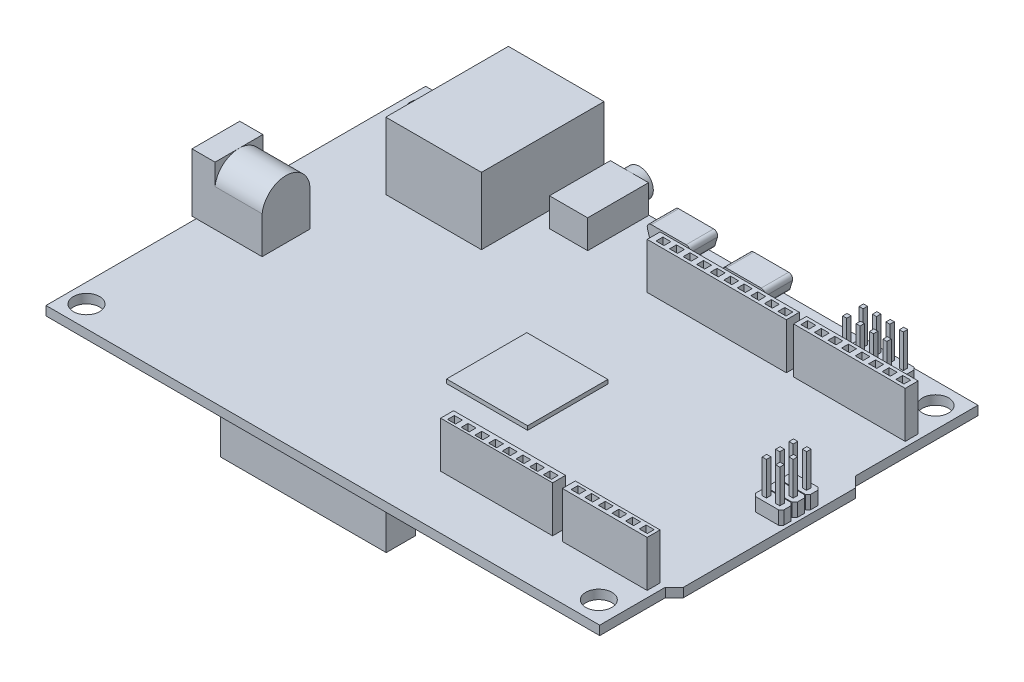
from build123d import *

# Parameters (mm, degrees)
BOSS_EXTRUDE1_DEPTH        = 1.7272
SKETCH2_W                  = 21.217281059
SKETCH2_H                  = 2.4511
SKETCH2_W_2                = 1.513193634
SKETCH2_H_2                = 1.296771929
SKETCH2_W_3                = 1.513193633
SKETCH2_W_4                = 26.382083001
SKETCH2_W_5                = 21.16618469
SKETCH2_W_6                = 16.065754975
BOSS_EXTRUDE2_DEPTH        = 8.7122
SKETCH3_W                  = 18.131785795
SKETCH3_H                  = 23.236925684
BOSS_EXTRUDE3_DEPTH        = 12.7
CUT_EXTRUDE1_DEPTH         = 13.076925684
SKETCH5_R                  = 2.483178102
CUT_EXTRUDE2_DEPTH         = 67.517320561
SKETCH6_W                  = 13.295757417
SKETCH6_H                  = 9.058997538
BOSS_EXTRUDE4_DEPTH        = 11.0617
CUT_EXTRUDE3_DEPTH         = 103.229340264
CUT_EXTRUDE3_DEPTH_BACK    = 8.921342
SKETCH8_R                  = 3.845118777
CUT_EXTRUDE4_DEPTH         = 10.755757417
SKETCH9_R                  = 0.95125876
BOSS_EXTRUDE5_DEPTH        = 9.485757417
FILLET1_R                  = 0.508
SKETCH10_W                 = 7.23202982
SKETCH10_H                 = 11.540892392
BOSS_EXTRUDE6_DEPTH        = 5.3975
SKETCH11_R                 = 2.615461053
BOSS_EXTRUDE8_DEPTH        = 1.905
SKETCH12_R                 = 2.059888478
CUT_EXTRUDE5_DEPTH         = 11.540892391
BOSS_EXTRUDE9_START        = -4.445
BOSS_EXTRUDE9_DEPTH        = 5.207
CUT_EXTRUDE6_DEPTH         = 4.699
LPATTERN1_COUNT            = 2
LPATTERN1_PITCH            = 14.224
SKETCH15_W                 = 2.566307228
SKETCH15_H                 = 5.471560695
BOSS_EXTRUDE10_DEPTH       = 1.524
CHAMFER1_SIZE              = 0.508
SKETCH16_W                 = 0.756408132
SKETCH16_H                 = 0.825705557
BOSS_EXTRUDE11_DEPTH       = 6.35
LPATTERN2_DEPTH            = 1.524
LPATTERN2_START            = 1.524
LPATTERN2_2_OUTLINE_W      = 0.756408132
LPATTERN2_2_OUTLINE_H      = 0.825705557
LPATTERN2_2_DEPTH          = 6.35
SKETCH17_W                 = 5.405221112
SKETCH17_H                 = 2.387582332
BOSS_EXTRUDE12_DEPTH       = 2.54
CHAMFER2_SIZE              = 0.508
SKETCH18_W                 = 0.799057006
SKETCH18_H                 = 0.852959092
BOSS_EXTRUDE13_DEPTH       = 6.35
LPATTERN3_COUNT            = 3
LPATTERN3_PITCH            = 2.54
CHAMFER2_OF_LPATTERN3_SIZE = 0.508
SKETCH19_W                 = 31.401054305
SKETCH19_H                 = 7.62
BOSS_EXTRUDE14_DEPTH       = 9.144
SKETCH20_W                 = 31.401054305
SKETCH20_H                 = 2.032
CUT_EXTRUDE7_DEPTH         = 2.54
CUT_EXTRUDE8_DEPTH         = 6.35
SKETCH23_W                 = 6.340454958
SKETCH23_H                 = 6.340454959
BOSS_EXTRUDE15_DEPTH       = 6.858
SKETCH24_W                 = 2.58532541
SKETCH24_H                 = 2.364612325
BOSS_EXTRUDE16_DEPTH       = 3.81
CUT_EXTRUDE10_DEPTH        = 3.81
SKETCH26_W                 = 18.796
SKETCH26_H                 = 3.305722841
BOSS_EXTRUDE17_DEPTH       = 3.81
SKETCH27_W                 = 15.358405724
SKETCH27_H                 = 15.207579987
BOSS_EXTRUDE18_DEPTH       = 0.762


# Read off the part's stored shape, not the designer's step: LPattern2
with BuildPart() as part:
    # Sketch1 → Boss-Extrude1 (new body)
    with BuildSketch(Plane(origin=(0, 0, 0), x_dir=(1, 0, 0), z_dir=(0, 1, 0))):
        Polygon((51.361416482, 35.975), (51.361416482, 12.721357533), (53.33, 10.752774016), (53.33, -21.826585236), (51.614836507, -23.54174873), (51.614836507, -35.975), (-53.33, -35.975), (-53.33, 35.975), align=None)
    extrude(amount=-BOSS_EXTRUDE1_DEPTH)

    # Sketch2 → Boss-Extrude2 (add)
    # profile 1 of 4: a face of its own
    with BuildSketch(Plane(origin=(0, 0, 0), x_dir=(1, 0, 0), z_dir=(0, 1, 0))):
        with Locations((21.887442101, -24.561512356)):
            Rectangle(SKETCH2_W, SKETCH2_H)
        with Locations((12.892277859, -24.693181102)):
            Rectangle(SKETCH2_W_2, SKETCH2_H_2, mode=Mode.SUBTRACT)
        with Locations((15.487359642, -24.693181102)):
            Rectangle(SKETCH2_W_2, SKETCH2_H_2, mode=Mode.SUBTRACT)
        with Locations((18.082441426, -24.693181102)):
            Rectangle(SKETCH2_W_3, SKETCH2_H_2, mode=Mode.SUBTRACT)
        with Locations((20.677523209, -24.693181102)):
            Rectangle(SKETCH2_W_3, SKETCH2_H_2, mode=Mode.SUBTRACT)
        with Locations((23.272604992, -24.693181102)):
            Rectangle(SKETCH2_W_2, SKETCH2_H_2, mode=Mode.SUBTRACT)
        with Locations((25.867686775, -24.693181102)):
            Rectangle(SKETCH2_W_2, SKETCH2_H_2, mode=Mode.SUBTRACT)
        with Locations((28.462768558, -24.693181102)):
            Rectangle(SKETCH2_W_2, SKETCH2_H_2, mode=Mode.SUBTRACT)
        with Locations((31.057850342, -24.693181102)):
            Rectangle(SKETCH2_W_3, SKETCH2_H_2, mode=Mode.SUBTRACT)
    # profile 2 of 4: a face of its own
    with BuildSketch(Plane(origin=(0, 0, 0), x_dir=(1, 0, 0), z_dir=(0, 1, 0))):
        with Locations((14.695869752, 24.354639302)):
            Rectangle(SKETCH2_W_4, SKETCH2_H)
        with Locations((5.934436371, 24.354639303)):
            Rectangle(SKETCH2_W_3, SKETCH2_H_2, mode=Mode.SUBTRACT)
        with Locations((3.366377141, 24.354639303)):
            Rectangle(SKETCH2_W_3, SKETCH2_H_2, mode=Mode.SUBTRACT)
        with Locations((8.5024956, 24.354639303)):
            Rectangle(SKETCH2_W_3, SKETCH2_H_2, mode=Mode.SUBTRACT)
        with Locations((11.070554831, 24.354639303)):
            Rectangle(SKETCH2_W_3, SKETCH2_H_2, mode=Mode.SUBTRACT)
        with Locations((13.638614061, 24.354639303)):
            Rectangle(SKETCH2_W_3, SKETCH2_H_2, mode=Mode.SUBTRACT)
        with Locations((16.20667329, 24.354639303)):
            Rectangle(SKETCH2_W_3, SKETCH2_H_2, mode=Mode.SUBTRACT)
        with Locations((18.77473252, 24.354639303)):
            Rectangle(SKETCH2_W_2, SKETCH2_H_2, mode=Mode.SUBTRACT)
        with Locations((21.34279175, 24.354639303)):
            Rectangle(SKETCH2_W_2, SKETCH2_H_2, mode=Mode.SUBTRACT)
        with Locations((23.91085098, 24.354639303)):
            Rectangle(SKETCH2_W_2, SKETCH2_H_2, mode=Mode.SUBTRACT)
        with Locations((26.47891021, 24.354639303)):
            Rectangle(SKETCH2_W_2, SKETCH2_H_2, mode=Mode.SUBTRACT)
    # profile 3 of 4: a face of its own
    with BuildSketch(Plane(origin=(0, 0, 0), x_dir=(1, 0, 0), z_dir=(0, 1, 0))):
        with Locations((39.830648216, 24.354639302)):
            Rectangle(SKETCH2_W_5, SKETCH2_H)
        with Locations((30.808480441, 24.359914849)):
            Rectangle(SKETCH2_W_3, SKETCH2_H_2, mode=Mode.SUBTRACT)
        with Locations((33.381224519, 24.359914849)):
            Rectangle(SKETCH2_W_3, SKETCH2_H_2, mode=Mode.SUBTRACT)
        with Locations((35.953968597, 24.359914849)):
            Rectangle(SKETCH2_W_3, SKETCH2_H_2, mode=Mode.SUBTRACT)
        with Locations((38.526712675, 24.359914849)):
            Rectangle(SKETCH2_W_2, SKETCH2_H_2, mode=Mode.SUBTRACT)
        with Locations((41.099456753, 24.359914849)):
            Rectangle(SKETCH2_W_2, SKETCH2_H_2, mode=Mode.SUBTRACT)
        with Locations((43.672200831, 24.359914849)):
            Rectangle(SKETCH2_W_2, SKETCH2_H_2, mode=Mode.SUBTRACT)
        with Locations((46.244944909, 24.359914849)):
            Rectangle(SKETCH2_W_2, SKETCH2_H_2, mode=Mode.SUBTRACT)
        with Locations((48.817688987, 24.359914849)):
            Rectangle(SKETCH2_W_2, SKETCH2_H_2, mode=Mode.SUBTRACT)
    # profile 4 of 4: a face of its own
    with BuildSketch(Plane(origin=(0, 0, 0), x_dir=(1, 0, 0), z_dir=(0, 1, 0))):
        with Locations((42.380863074, -24.561512356)):
            Rectangle(SKETCH2_W_6, SKETCH2_H)
        with Locations((36.113955365, -24.495526938)):
            Rectangle(SKETCH2_W_3, SKETCH2_H_2, mode=Mode.SUBTRACT)
        with Locations((38.700163929, -24.495526938)):
            Rectangle(SKETCH2_W_2, SKETCH2_H_2, mode=Mode.SUBTRACT)
        with Locations((41.286372494, -24.495526938)):
            Rectangle(SKETCH2_W_2, SKETCH2_H_2, mode=Mode.SUBTRACT)
        with Locations((43.872581059, -24.495526938)):
            Rectangle(SKETCH2_W_3, SKETCH2_H_2, mode=Mode.SUBTRACT)
        with Locations((46.458789624, -24.495526938)):
            Rectangle(SKETCH2_W_3, SKETCH2_H_2, mode=Mode.SUBTRACT)
        with Locations((49.044998188, -24.495526938)):
            Rectangle(SKETCH2_W_2, SKETCH2_H_2, mode=Mode.SUBTRACT)
    extrude(amount=BOSS_EXTRUDE2_DEPTH)

    # Sketch3 → Boss-Extrude3 (add)
    with BuildSketch(Plane(origin=(0, 0, 0), x_dir=(1, 0, 0), z_dir=(0, 1, 0))):
        with Locations((-30.278321912, 26.053476777)):
            Rectangle(SKETCH3_W, SKETCH3_H)
    extrude(amount=BOSS_EXTRUDE3_DEPTH)

    # Sketch4 → Cut-Extrude1 (cut)
    with BuildSketch(Plane(origin=(0, 0, -37.671939619), x_dir=(-1, 0, 0), z_dir=(0, 0, -1))):
        Polygon((27.837662892, 10.126027768), (27.837662892, 11.937827276), (32.718980931, 11.937827276), (32.718980931, 10.126027768), (37.5005936, 10.126027768), (37.5005936, 1.167685758), (23.056050223, 1.167685758), (23.056050223, 10.126027768), align=None)
    extrude(amount=-CUT_EXTRUDE1_DEPTH, mode=Mode.SUBTRACT)

    # Sketch5 → Cut-Extrude2 (cut, through all)
    with BuildSketch(Plane(origin=(0, 0, 0), x_dir=(1, 0, 0), z_dir=(0, 1, 0))):
        with Locations(Location((-49.71750702, 31.911979039, 0), (0, 0, 270))):
            Circle(SKETCH5_R)
        with Locations(Location((47.377368709, 31.911979039, 0), (0, 0, 270))):
            Circle(SKETCH5_R)
        with Locations(Location((47.377368709, -31.908062762, 0), (0, 0, 270))):
            Circle(SKETCH5_R)
        with Locations(Location((-49.71750702, -31.908062762, 0), (0, 0, 270))):
            Circle(SKETCH5_R)
    extrude(amount=-CUT_EXTRUDE2_DEPTH, mode=Mode.SUBTRACT)

    # Sketch6 → Boss-Extrude4 (add)
    with BuildSketch(Plane(origin=(0, 0, 0), x_dir=(1, 0, 0), z_dir=(0, 1, 0))):
        with Locations((-47.500536221, -2.963140184)):
            Rectangle(SKETCH6_W, SKETCH6_H)
    extrude(amount=BOSS_EXTRUDE4_DEPTH)

    # Sketch7 → Cut-Extrude3 (cut, two sides: drawn at the far end of the back side and taken through both)
    with BuildSketch(Plane(origin=(-40.852657513, 0, 0), x_dir=(0, 0, -1), z_dir=(1, 0, 0)).offset(-CUT_EXTRUDE3_DEPTH_BACK)):
        with BuildLine():
            Line((-7.492638953, 7.04685454), (-7.492638953, 13.052105642))
            Line((-7.492638953, 13.052105642), (1.566358585, 13.052105642))
            Line((1.566358585, 13.052105642), (1.566358585, 7.04685454))
            ThreePointArc((1.566358585, 7.04685454), (-2.963140184, 11.0617), (-7.492638953, 7.04685454))
        make_face()
    extrude(amount=CUT_EXTRUDE3_DEPTH + CUT_EXTRUDE3_DEPTH_BACK, mode=Mode.SUBTRACT)

    # Sketch8 → Cut-Extrude4 (cut)
    with BuildSketch(Plane.ZY.offset(54.14841493)):
        with Locations((2.963140184, 6.499215151)):
            Circle(SKETCH8_R)
    extrude(amount=-CUT_EXTRUDE4_DEPTH, mode=Mode.SUBTRACT)

    # Sketch9 → Boss-Extrude5 (add)
    with BuildSketch(Plane.ZY.offset(43.392657513)):
        with Locations(Location((2.963140184, 6.499215151, 0), (0, 0, 180))):
            Circle(SKETCH9_R)
    extrude(amount=BOSS_EXTRUDE5_DEPTH)

    # Fillet1
    fillet1_edges = [part.edges().sort_by_distance(p)[0] for p in [
        (-52.87841493, 6.499215151, 3.914398944),
    ]]
    fillet(fillet1_edges, radius=FILLET1_R)

    # Sketch10 → Boss-Extrude6 (add)
    with BuildSketch(Plane(origin=(0, 0, 0), x_dir=(1, 0, 0), z_dir=(0, 1, 0))):
        with Locations((-14.60400572, 30.111460287)):
            Rectangle(SKETCH10_W, SKETCH10_H)
    extrude(amount=BOSS_EXTRUDE6_DEPTH)

    # Sketch11 → Boss-Extrude8 (add)
    with BuildSketch(Plane(origin=(0, 0, -35.881906483), x_dir=(-1, 0, 0), z_dir=(0, 0, -1))):
        with Locations(Location((14.60400572, 2.69875, 0), (0, 0, 180))):
            Circle(SKETCH11_R)
    extrude(amount=BOSS_EXTRUDE8_DEPTH)

    # Sketch12 → Cut-Extrude5 (cut)
    with BuildSketch(Plane(origin=(0, 0, -37.786906483), x_dir=(-1, 0, 0), z_dir=(0, 0, -1))):
        with Locations((14.60400572, 2.69875)):
            Circle(SKETCH12_R)
    extrude(amount=-CUT_EXTRUDE5_DEPTH, mode=Mode.SUBTRACT)

    # Sketch13 → Boss-Extrude9 (add)
    with BuildSketch(Plane(origin=(0, 0, -35.975), x_dir=(-1, 0, 0), z_dir=(0, 0, -1)).offset(BOSS_EXTRUDE9_START)):
        with BuildLine():
            Line((-14.236695776, 0), (-8.585922104, 0))
            ThreePointArc((-8.585922104, 0), (-8.13148913, 0.150334509), (-7.856365758, 0.542019232))
            Line((-7.856365758, 0.542019232), (-7.373862622, 2.142219232))
            ThreePointArc((-7.373862622, 2.142219232), (-7.491753477, 2.816632974), (-8.103418968, 3.1242))
            Line((-8.103418968, 3.1242), (-14.719198912, 3.1242))
            ThreePointArc((-14.719198912, 3.1242), (-15.330864402, 2.816632974), (-15.448755257, 2.142219232))
            Line((-15.448755257, 2.142219232), (-14.966252121, 0.542019232))
            ThreePointArc((-14.966252121, 0.542019232), (-14.691128749, 0.150334509), (-14.236695776, 0))
        make_face()
    boss_extrude9 = extrude(amount=BOSS_EXTRUDE9_DEPTH)

    # Sketch14 → Cut-Extrude6 (cut)
    with BuildSketch(Plane(origin=(0, 0, -36.737), x_dir=(-1, 0, 0), z_dir=(0, 0, -1))):
        with BuildLine():
            Line((-8.103418968, 2.8702), (-14.719198912, 2.8702))
            ThreePointArc((-14.719198912, 2.8702), (-15.126975905, 2.665155316), (-15.205569809, 2.215546155))
            Line((-15.205569809, 2.215546155), (-14.723066673, 0.615346155))
            ThreePointArc((-14.723066673, 0.615346155), (-14.539651091, 0.354223006), (-14.236695776, 0.254))
            Line((-14.236695776, 0.254), (-11.591805715, 0.254))
            Line((-11.591805715, 0.254), (-11.591805715, 0))
            Line((-11.591805715, 0), (-11.230812165, 0))
            Line((-11.230812165, 0), (-11.230812165, 0.254))
            Line((-11.230812165, 0.254), (-8.585922104, 0.254))
            ThreePointArc((-8.585922104, 0.254), (-8.282966788, 0.354223006), (-8.099551207, 0.615346155))
            Line((-8.099551207, 0.615346155), (-7.617048071, 2.215546155))
            ThreePointArc((-7.617048071, 2.215546155), (-7.695641974, 2.665155316), (-8.103418968, 2.8702))
        make_face()
    cut_extrude6 = extrude(amount=-CUT_EXTRUDE6_DEPTH, mode=Mode.SUBTRACT)

    # LPattern1: Boss-Extrude9, Cut-Extrude6 ×2
    with Locations(*[(-i * LPATTERN1_PITCH, 0, 0) for i in range(1, LPATTERN1_COUNT)]):
        add(boss_extrude9)
        add(cut_extrude6, mode=Mode.SUBTRACT)

    # Sketch15 → Boss-Extrude10 (add)
    with BuildSketch(Plane(origin=(0, 0, 0), x_dir=(1, 0, 0), z_dir=(0, 1, 0))):
        with Locations((32.140541448, 31.899882326)):
            Rectangle(SKETCH15_W, SKETCH15_H)
    extrude(amount=BOSS_EXTRUDE10_DEPTH)

    # Chamfer1
    chamfer1_edges = [part.edges().sort_by_distance(p)[0] for p in [
        (30.857387834, 0.762, -34.635662673),
        (30.857387834, 0.762, -29.164101978),
        (33.423695062, 0.762, -29.164101978),
        (33.423695062, 0.762, -34.635662673),
    ]]
    chamfer(chamfer1_edges, length=CHAMFER1_SIZE)

    # Sketch16 → Boss-Extrude11 (add)
    with BuildSketch(Plane(origin=(0, 1.524, 0), x_dir=(1, 0, 0), z_dir=(0, 1, 0))):
        with Locations((32.140541448, 30.343807186)):
            Rectangle(SKETCH16_W, SKETCH16_H)
        with Locations((32.140541448, 33.455957466)):
            Rectangle(SKETCH16_W, SKETCH16_H)
    extrude(amount=BOSS_EXTRUDE11_DEPTH)

    # LPattern2 outline → LPattern2 (add)
    with BuildSketch(Plane(origin=(0, 0, 0), x_dir=(1, 0, 0), z_dir=(0, 1, 0))):
        Polygon((33.905387834, 29.164101978), (35.455695062, 29.164101978), (35.950541448, 29.658948364), (36.445387834, 29.164101978), (37.995695062, 29.164101978), (38.490541448, 29.658948364), (38.985387834, 29.164101978), (40.535695062, 29.164101978), (41.043695062, 29.672101978), (41.043695062, 34.127662673), (40.535695062, 34.635662673), (38.985387834, 34.635662673), (38.490541448, 34.140816287), (37.995695062, 34.635662673), (36.445387834, 34.635662673), (35.950541448, 34.140816287), (35.455695062, 34.635662673), (33.905387834, 34.635662673), (33.410541448, 34.140816287), (33.423695062, 34.127662673), (33.423695062, 29.672101978), (33.410541448, 29.658948364), align=None)
    extrude(amount=LPATTERN2_DEPTH)

    # LPattern2 2 outline → LPattern2 2 (add)
    with BuildSketch(Plane(origin=(0, 0, 0), x_dir=(1, 0, 0), z_dir=(0, 1, 0)).offset(LPATTERN2_START)):
        with Locations((34.680541448, 33.455957466)):
            Rectangle(LPATTERN2_2_OUTLINE_W, LPATTERN2_2_OUTLINE_H)
        with Locations((37.220541448, 33.455957466)):
            Rectangle(LPATTERN2_2_OUTLINE_W, LPATTERN2_2_OUTLINE_H)
        with Locations((39.760541448, 33.455957466)):
            Rectangle(LPATTERN2_2_OUTLINE_W, LPATTERN2_2_OUTLINE_H)
        with Locations((34.680541448, 30.343807186)):
            Rectangle(LPATTERN2_2_OUTLINE_W, LPATTERN2_2_OUTLINE_H)
        with Locations((37.220541448, 30.343807186)):
            Rectangle(LPATTERN2_2_OUTLINE_W, LPATTERN2_2_OUTLINE_H)
        with Locations((39.760541448, 30.343807186)):
            Rectangle(LPATTERN2_2_OUTLINE_W, LPATTERN2_2_OUTLINE_H)
    extrude(amount=LPATTERN2_2_DEPTH)

    # Sketch17 → Boss-Extrude12 (add)
    with BuildSketch(Plane(origin=(0, 0, 0), x_dir=(1, 0, 0), z_dir=(0, 1, 0))):
        with Locations((49.969340977, 3.638067028)):
            Rectangle(SKETCH17_W, SKETCH17_H)
    boss_extrude12 = extrude(amount=BOSS_EXTRUDE12_DEPTH)

    # Chamfer2
    chamfer2_edges = [part.edges().sort_by_distance(p)[0] for p in [
        (47.266730421, 1.27, -4.831858194),
        (47.266730421, 1.27, -2.444275862),
        (52.671951533, 1.27, -2.444275862),
        (52.671951533, 1.27, -4.831858194),
    ]]
    chamfer(chamfer2_edges, length=CHAMFER2_SIZE)

    # Sketch18 → Boss-Extrude13 (add)
    with BuildSketch(Plane(origin=(0, 2.54, 0), x_dir=(1, 0, 0), z_dir=(0, 1, 0))):
        with Locations((48.699340977, 3.638067028)):
            Rectangle(SKETCH18_W, SKETCH18_H)
        with Locations((51.239340977, 3.638067028)):
            Rectangle(SKETCH18_W, SKETCH18_H)
    boss_extrude13 = extrude(amount=BOSS_EXTRUDE13_DEPTH)

    # LPattern3: Boss-Extrude12, Boss-Extrude13 ×3
    with Locations(*[(0, 0, i * LPATTERN3_PITCH) for i in range(1, LPATTERN3_COUNT)]):
        add(boss_extrude12)
        add(boss_extrude13)

    # Chamfer2 of LPattern3
    chamfer2_of_lpattern3_edges = [part.edges().sort_by_distance(p)[0] for p in [
        (47.266730421, 1.27, -2.291858194),
        (47.266730421, 1.27, 0.095724138),
        (52.671951533, 1.27, 0.095724138),
        (52.671951533, 1.27, -2.291858194),
        (47.266730421, 1.27, 0.248141806),
        (47.266730421, 1.27, 2.635724138),
        (52.671951533, 1.27, 2.635724138),
        (52.671951533, 1.27, 0.248141806),
    ]]
    chamfer(chamfer2_of_lpattern3_edges, length=CHAMFER2_OF_LPATTERN3_SIZE)

    # Sketch19 → Boss-Extrude14 (add)
    with BuildSketch(Plane.XZ.offset(1.7272)):
        with Locations((-7.08382712, 29.625)):
            Rectangle(SKETCH19_W, SKETCH19_H)
    extrude(amount=BOSS_EXTRUDE14_DEPTH)

    # Sketch20 → Cut-Extrude7 (cut)
    with BuildSketch(Plane.XZ.offset(10.8712)):
        with Locations((-7.08382712, 26.831)):
            Rectangle(SKETCH20_W, SKETCH20_H)
    extrude(amount=-CUT_EXTRUDE7_DEPTH, mode=Mode.SUBTRACT)

    # Sketch21 → Cut-Extrude8 (cut)
    with BuildSketch(Plane(origin=(0, 0, 25.815), x_dir=(-1, 0, 0), z_dir=(0, 0, -1))):
        Polygon((21.14926178, -8.3312), (21.14926178, -7.80050592), (4.740153087, -7.80050592), (4.740153087, -8.3312), (1.476806404, -8.3312), (1.476806404, -7.80050592), (-7.217209049, -7.80050592), (-7.217209049, -10.378645231), (21.14926178, -10.378645231), align=None)
    extrude(amount=-CUT_EXTRUDE8_DEPTH, mode=Mode.SUBTRACT)

    # Sketch23 → Boss-Extrude15 (add)
    with BuildSketch(Plane.XZ.offset(1.7272)):
        with Locations((-19.336685896, -18.866082027)):
            Rectangle(SKETCH23_W, SKETCH23_H)
    boss_extrude15 = extrude(amount=BOSS_EXTRUDE15_DEPTH)

    # Sketch24 → Boss-Extrude16 (add)
    with BuildSketch(Plane.XZ.offset(8.5852)):
        with Locations((-20.366923864, -18.871628079)):
            Rectangle(SKETCH24_W, SKETCH24_H)
    boss_extrude16 = extrude(amount=BOSS_EXTRUDE16_DEPTH)

    # Sketch25 → Cut-Extrude10 (cut)
    with BuildSketch(Plane(origin=(0, 0, -20.053934242), x_dir=(-1, 0, 0), z_dir=(0, 0, -1))):
        Polygon((20.452892409, -8.5852), (20.452892409, -10.378645231), (21.659586569, -10.378645231), (20.021801155, -12.3952), (23.172083399, -12.3952), (23.172083399, -8.5852), align=None)
    cut_extrude10 = extrude(amount=-CUT_EXTRUDE10_DEPTH, mode=Mode.SUBTRACT)

    # Mirror1: Boss-Extrude15, Boss-Extrude16, Cut-Extrude10 across plane
    add(boss_extrude15.mirror(Plane(origin=(-6.768458417, 0, 0), x_dir=(0, 0, 1), z_dir=(1, 0, 0))))
    add(boss_extrude16.mirror(Plane(origin=(-6.768458417, 0, 0), x_dir=(0, 0, 1), z_dir=(1, 0, 0))))
    add(cut_extrude10.mirror(Plane(origin=(-6.768458417, 0, 0), x_dir=(0, 0, 1), z_dir=(1, 0, 0))), mode=Mode.SUBTRACT)

    # Sketch26 → Boss-Extrude17 (add)
    with BuildSketch(Plane.XZ.offset(1.7272)):
        with Locations((-6.768458417, -18.776251286)):
            Rectangle(SKETCH26_W, SKETCH26_H)
    extrude(amount=BOSS_EXTRUDE17_DEPTH)

    # Sketch27 → Boss-Extrude18 (add)
    with BuildSketch(Plane(origin=(0, 0, 0), x_dir=(1, 0, 0), z_dir=(0, 1, 0))):
        with Locations((5.13440214, -3.23349144)):
            Rectangle(SKETCH27_W, SKETCH27_H)
    extrude(amount=BOSS_EXTRUDE18_DEPTH)


solid = part.part
